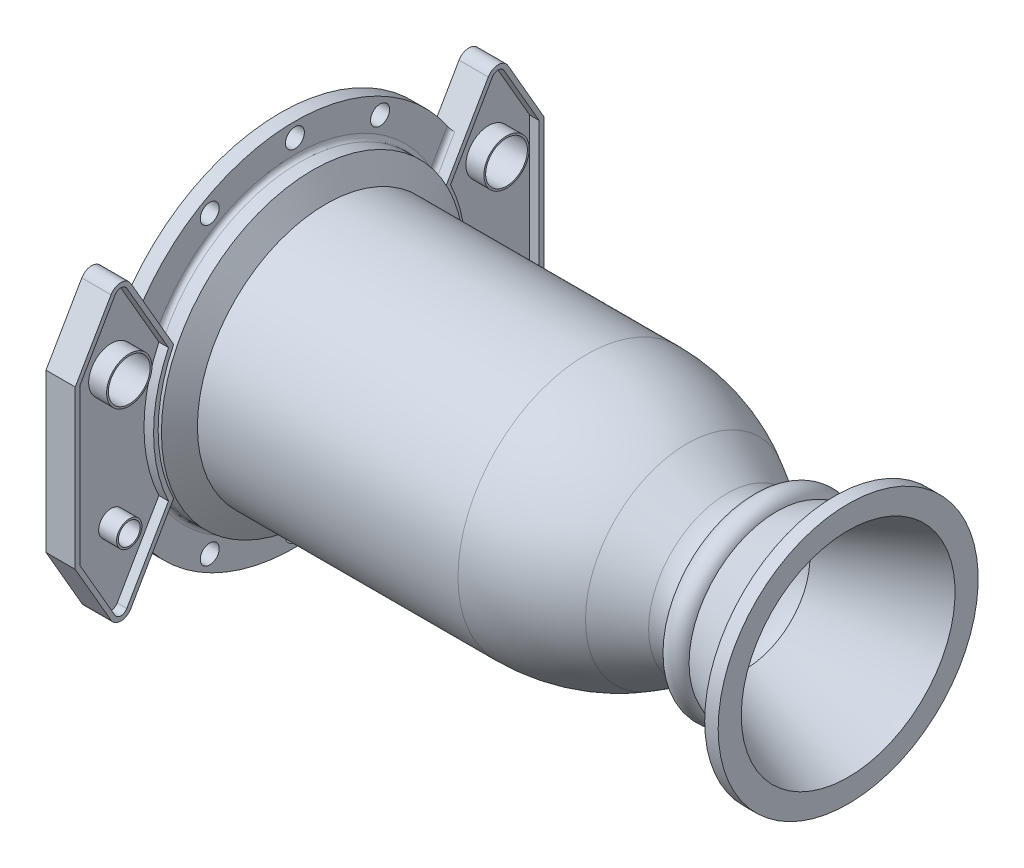
from build123d import *
from build123d.topology import SkipClean

# Parameters (mm, degrees)
BOSS_EXTRUDE1_DEPTH     = 16.256
CUT_EXTRUDE1_DEPTH      = 5.334
BOSS_EXTRUDE2_START     = -8.128
BOSS_EXTRUDE2_DEPTH     = 8.128
FILLET2_R               = 2.54
SKETCH9_R               = 5.275
CUT_EXTRUDE2_DEPTH      = 419.885269444
SKETCH10_R              = 11.6
SKETCH10_R_2            = 6.05
CUT_EXTRUDE3_DEPTH      = 417.321354466
BOSS_EXTRUDE3_START     = 10
SKETCH11_R              = 12.6
SKETCH11_R_2            = 11.6
SKETCH11_R_3            = 7.05
SKETCH11_R_4            = 6.05
BOSS_EXTRUDE3_DEPTH     = 10
CUT_EXTRUDE4_DEPTH      = 404.084600433
CUT_EXTRUDE4_DEPTH_BACK = 404.084600433
SKETCH17_W              = 85
SKETCH17_H              = 190


with BuildPart() as part:
    # Sketch3 → Revolve1 (revolve)
    with BuildSketch(Plane.XY):
        with BuildLine():
            Line((0, 71.5011717), (144.934666475, 71.5011717))
            ThreePointArc((144.934666475, 71.5011717), (173.892574508, 67.688769671), (200.877042723, 56.51141211))
            Line((200.877042723, 56.51141211), (223.127154881, 43.665279514))
            ThreePointArc((223.127154881, 43.665279514), (227.625034583, 41.721337074), (232.448772375, 40.860298318))
            add(Edge.make_bspline(
                [(232.448772375, 40.860298318), (234.86856203, 41.933657894), (240.173238318, 44.266655644), (251.176182965, 49.013937562), (265.440009786, 54.97345202), (282.448229164, 61.765962568), (299.354503113, 68.202057856), (316.156963457, 74.280596731), (332.857651733, 80.001884245), (346.685594207, 84.470267584), (357.704525634, 87.868146407), (363.182392167, 89.503083437), (365.9308663, 90.309661005)],
                knots=[0.492875979, 0.492875979, 0.492875979, 0.492875979, 0.492966882, 0.493074775, 0.493290561, 0.493506346, 0.493722132, 0.493937918, 0.494153704, 0.494369489, 0.494477382, 0.494585275, 0.494585275, 0.494585275, 0.494585275], degree=3))
            Line((365.9308663, 90.309661005), (367.338810321, 85.511985147))
            add(Edge.make_bspline(
                [(233.424633311, 35.822756061), (236.183141196, 37.049408729), (241.820242455, 39.531718175), (253.12775411, 44.410404122), (267.331680592, 50.344882311), (284.265598042, 57.10770533), (301.095145103, 63.51457761), (317.818383555, 69.564442688), (334.43732724, 75.257710839), (348.19495997, 79.703362784), (359.156425704, 83.083517043), (364.604957844, 84.709698506), (367.338810321, 85.511985147)],
                knots=[0.492862754, 0.492862754, 0.492862754, 0.492862754, 0.492966882, 0.493074775, 0.493290561, 0.493506346, 0.493722132, 0.493937918, 0.494153704, 0.494369489, 0.494477382, 0.494585275, 0.494585275, 0.494585275, 0.494585275], degree=3))
            ThreePointArc((233.424633311, 35.822756061), (226.800103593, 36.756276843), (220.627157517, 39.335150973))
            Line((220.627157517, 39.335150973), (198.377039169, 52.181287144))
            ThreePointArc((198.377039169, 52.181287144), (172.598474463, 62.859141831), (144.9346606, 66.5011717))
            Line((144.9346606, 66.5011717), (0, 66.5011717))
            Line((0, 66.5011717), (0, 71.5011717))
        make_face()
    revolve(axis=Axis((0, 0, 0), (1, 0, 0)))

    # Sketch4 → Revolve5 (revolve)
    with BuildSketch(Plane.XY):
        Polygon((-25.4, 66.5011717), (-25.4, 84.2011717), (-7.332348419, 84.2011717), (0, 71.5011717), (0, 66.5011717), align=None)
    revolve(axis=Axis((0, 0, 0), (1, 0, 0)))

    # Sketch6 → Boss-Extrude1 (add)
    with SkipClean():  # the faces are left unmerged after this step: merging them gives an invalid solid
        with BuildSketch(Plane.ZY.offset(25.4)):
            with BuildLine():
                Line((64.197098299, 17.35333995), (99.428641487, 78.37616278))
                ThreePointArc((99.428641487, 78.37616278), (104.927902801, 81.55116278), (110.427164115, 78.37616278))
                Line((110.427164115, 78.37616278), (130.327902801, 43.907072268))
                Line((130.327902801, 43.907072268), (130.327902801, -43.907072268))
                Line((130.327902801, -43.907072268), (110.427164115, -78.37616278))
                ThreePointArc((110.427164115, -78.37616278), (104.927902801, -81.55116278), (99.428641487, -78.37616278))
                Line((99.428641487, -78.37616278), (64.197098299, -17.35333995))
                ThreePointArc((64.197098299, -17.35333995), (66.5011717, 0), (64.197098299, 17.35333995))
            make_face()
            with BuildLine():
                Line((-64.197098299, -17.35333995), (-99.428641487, -78.37616278))
                ThreePointArc((-99.428641487, -78.37616278), (-104.927902801, -81.55116278), (-110.427164115, -78.37616278))
                Line((-110.427164115, -78.37616278), (-130.327902801, -43.907072268))
                Line((-130.327902801, -43.907072268), (-130.327902801, 43.907072268))
                Line((-130.327902801, 43.907072268), (-110.427164115, 78.37616278))
                ThreePointArc((-110.427164115, 78.37616278), (-104.927902801, 81.55116278), (-99.428641487, 78.37616278))
                Line((-99.428641487, 78.37616278), (-64.197098299, 17.35333995))
                ThreePointArc((-64.197098299, 17.35333995), (-66.5011717, 0), (-64.197098299, -17.35333995))
            make_face()
        extrude(amount=-BOSS_EXTRUDE1_DEPTH)

    # Sketch7 → Cut-Extrude1 (cut)
    with SkipClean():  # the faces are left unmerged after this step: merging them gives an invalid solid
        with BuildSketch(Plane(origin=(-9.144, 0, 0), x_dir=(0, 0, -1), z_dir=(1, 0, 0))):
            with BuildLine():
                Line((-78.462562562, 36.981848846), (-101.628346013, 77.10616278))
                ThreePointArc((-101.628346013, 77.10616278), (-104.927902801, 79.01116278), (-108.22745959, 77.10616278))
                Line((-108.22745959, 77.10616278), (-127.787902801, 43.226481319))
                Line((-127.787902801, 43.226481319), (-127.787902801, -43.226481319))
                Line((-127.787902801, -43.226481319), (-108.22745959, -77.10616278))
                ThreePointArc((-108.22745959, -77.10616278), (-104.927902801, -79.01116278), (-101.628346013, -77.10616278))
                Line((-101.628346013, -77.10616278), (-78.462562562, -36.981848846))
                ThreePointArc((-78.462562562, -36.981848846), (-86.7411717, 0), (-78.462562562, 36.981848846))
            make_face()
            with BuildLine():
                Line((101.628346013, -77.10616278), (78.462562562, -36.981848846))
                ThreePointArc((78.462562562, -36.981848846), (86.7411717, 0), (78.462562562, 36.981848846))
                Line((78.462562562, 36.981848846), (101.628346013, 77.10616278))
                ThreePointArc((101.628346013, 77.10616278), (104.927902801, 79.01116278), (108.22745959, 77.10616278))
                Line((108.22745959, 77.10616278), (127.787902801, 43.226481319))
                Line((127.787902801, 43.226481319), (127.787902801, -43.226481319))
                Line((127.787902801, -43.226481319), (108.22745959, -77.10616278))
                ThreePointArc((108.22745959, -77.10616278), (104.927902801, -79.01116278), (101.628346013, -77.10616278))
            make_face()
        extrude(amount=-CUT_EXTRUDE1_DEPTH, mode=Mode.SUBTRACT)

    # Sketch8 → Boss-Extrude2 (add)
    with SkipClean():  # the faces are left unmerged after this step: merging them gives an invalid solid
        with BuildSketch(Plane.ZY.offset(25.4).offset(BOSS_EXTRUDE2_START)):
            with BuildLine():
                Line((-75.592096587, 37.090055935), (-86.329826389, 55.688349511))
                ThreePointArc((-86.329826389, 55.688349511), (0, 102.7328146), (86.329826389, 55.688349511))
                Line((86.329826389, 55.688349511), (75.592096587, 37.090055935))
                ThreePointArc((75.592096587, 37.090055935), (0, 84.2011717), (-75.592096587, 37.090055935))
            make_face()
            with BuildLine():
                Line((86.329826389, -55.688349511), (75.592096587, -37.090055935))
                ThreePointArc((75.592096587, -37.090055935), (0, -84.2011717), (-75.592096587, -37.090055935))
                Line((-75.592096587, -37.090055935), (-86.329826389, -55.688349511))
                ThreePointArc((-86.329826389, -55.688349511), (0, -102.7328146), (86.329826389, -55.688349511))
            make_face()
        extrude(amount=BOSS_EXTRUDE2_DEPTH)

    # Fillet2
    fillet2_edges = [part.edges().sort_by_distance(p)[0] for p in [
        (-17.272, 46.389202723, 80.960961488),
        (-17.272, 71.459301297, 44.535441771),
        (-17.272, 46.389202723, -80.960961488),
        (-17.272, -46.389202723, -80.960961488),
        (-17.272, -84.2011717, 0),
        (-17.272, -46.389202723, 80.960961488),
    ]]
    fillet(fillet2_edges, radius=FILLET2_R)

    # Sketch9 → Cut-Extrude2 (cut, through all)
    with SkipClean():  # the faces are left unmerged after this step: merging them gives an invalid solid
        with BuildSketch(Plane(origin=(-17.272, 0, 0), x_dir=(0, 0, -1), z_dir=(1, 0, 0))):
            with Locations((0, 94.73699315)):
                Circle(SKETCH9_R)
            with Locations((-47.368496575, 82.044642746)):
                Circle(SKETCH9_R)
            with Locations((47.368496575, 82.044642746)):
                Circle(SKETCH9_R)
            with Locations((47.368496575, -82.044642746)):
                Circle(SKETCH9_R)
            with Locations((0, -94.73699315)):
                Circle(SKETCH9_R)
            with Locations((-47.368496575, -82.044642746)):
                Circle(SKETCH9_R)
        extrude(amount=-CUT_EXTRUDE2_DEPTH, mode=Mode.SUBTRACT)

    # Sketch10 → Cut-Extrude3 (cut, through all)
    with SkipClean():  # the faces are left unmerged after this step: merging them gives an invalid solid
        with BuildSketch(Plane(origin=(-14.478, 0, 0), x_dir=(0, 0, -1), z_dir=(1, 0, 0))):
            with Locations((-104.927902801, 36.981848846)):
                Circle(SKETCH10_R)
            with Locations((-104.927902801, -36.981848846)):
                Circle(SKETCH10_R_2)
            with Locations((104.927902801, -36.981848846)):
                Circle(SKETCH10_R_2)
            with Locations((104.927902801, 36.981848846)):
                Circle(SKETCH10_R)
        extrude(amount=-CUT_EXTRUDE3_DEPTH, mode=Mode.SUBTRACT)

    # Sketch11 → Boss-Extrude3 (add)
    # profile 1 of 4: a face of its own
    with SkipClean():  # the faces are left unmerged after this step: merging them gives an invalid solid
        with BuildSketch(Plane(origin=(-14.478, 0, 0), x_dir=(0, 0, -1), z_dir=(1, 0, 0)).offset(BOSS_EXTRUDE3_START)):
            with Locations((-104.927902801, 36.981848846)):
                Circle(SKETCH11_R)
            with Locations((-104.927902801, 36.981848846)):
                Circle(SKETCH11_R_2, mode=Mode.SUBTRACT)
        # profile 2 of 4: a face of its own
        with BuildSketch(Plane(origin=(-14.478, 0, 0), x_dir=(0, 0, -1), z_dir=(1, 0, 0)).offset(BOSS_EXTRUDE3_START)):
            with Locations((-104.927902801, -36.981848846)):
                Circle(SKETCH11_R_3)
            with Locations((-104.927902801, -36.981848846)):
                Circle(SKETCH11_R_4, mode=Mode.SUBTRACT)
        # profile 3 of 4: a face of its own
        with BuildSketch(Plane(origin=(-14.478, 0, 0), x_dir=(0, 0, -1), z_dir=(1, 0, 0)).offset(BOSS_EXTRUDE3_START)):
            with Locations((104.927902801, -36.981848846)):
                Circle(SKETCH11_R_3)
            with Locations((104.927902801, -36.981848846)):
                Circle(SKETCH11_R_4, mode=Mode.SUBTRACT)
        # profile 4 of 4: a face of its own
        with BuildSketch(Plane(origin=(-14.478, 0, 0), x_dir=(0, 0, -1), z_dir=(1, 0, 0)).offset(BOSS_EXTRUDE3_START)):
            with Locations((104.927902801, 36.981848846)):
                Circle(SKETCH11_R)
            with Locations((104.927902801, 36.981848846)):
                Circle(SKETCH11_R_2, mode=Mode.SUBTRACT)
        extrude(amount=-BOSS_EXTRUDE3_DEPTH)

    # Sketch13 → Revolve6 (revolve)
    with SkipClean():  # the faces are left unmerged after this step: merging them gives an invalid solid
        with BuildSketch(Plane.XY):
            with BuildLine():
                ThreePointArc((237.023320854, 42.878559039), (240.940819009, 52.72904414), (250.79551716, 48.822156264))
                add(Edge.make_bspline(
                    [(250.79551716, 48.822156264), (247.934025386, 47.60808257), (243.338694509, 45.637401234), (238.755520688, 43.638668497), (237.023320854, 42.878559039)],
                    knots=[0.85959969, 0.85959969, 0.85959969, 0.85959969, 0.925062312, 0.964900055, 0.964900055, 0.964900055, 0.964900055], degree=3))
            make_face()
        revolve(axis=Axis((0, 0, 0), (1, 0, 0)))

    # Sketch17 → Cut-Extrude4 (cut, two sides: drawn at the far end of the back side and taken through both)
    with SkipClean():  # the faces are left unmerged after this step: merging them gives an invalid solid
        with BuildSketch(Plane.XY.offset(-CUT_EXTRUDE4_DEPTH_BACK)):
            with Locations((332.986, 0)):
                Rectangle(SKETCH17_W, SKETCH17_H)
        extrude(amount=CUT_EXTRUDE4_DEPTH + CUT_EXTRUDE4_DEPTH_BACK, mode=Mode.SUBTRACT)


with BuildPart() as revolve7_tool:
    # Sketch18 → Revolve7 (revolve)
    with SkipClean():  # the faces are left unmerged after this step: merging them gives an invalid solid
        with BuildSketch(Plane.XY):
            with BuildLine():
                Line((290.485992633, 64.812545394), (290.485992633, 72.312545394))
                Line((290.485992633, 72.312545394), (282.985992633, 72.312545394))
                Line((282.985992633, 72.312545394), (282.985992633, 61.922774445))
                add(Edge.make_bspline(
                    [(290.485992633, 64.812545394), (290.247936364, 64.721756415), (289.765818946, 64.537888338), (289.03975588, 64.260247587), (287.818867395, 63.792468409), (285.79999886, 63.015627681), (284.026792214, 62.328112458), (282.985992633, 61.922774445)],
                    knots=[0, 0, 0, 0, 0.017861436, 0.03617342, 0.054495182, 0.109519182, 0.187822524, 0.187822524, 0.187822524, 0.187822524], degree=3))
            make_face()
        revolve(axis=Axis((0, 0, 0), (1, 0, 0)))


with BuildPart() as part_1:
    with SkipClean():  # the faces are left unmerged after this step: merging them gives an invalid solid
        add(part.part)


with BuildPart() as part_2:
    # Revolve7: joined with revolve7_tool
    with SkipClean():  # the faces are left unmerged after this step: merging them gives an invalid solid
        add(part_1.part.fuse(revolve7_tool.part, tol=0.00001))


solid = part_2.part
